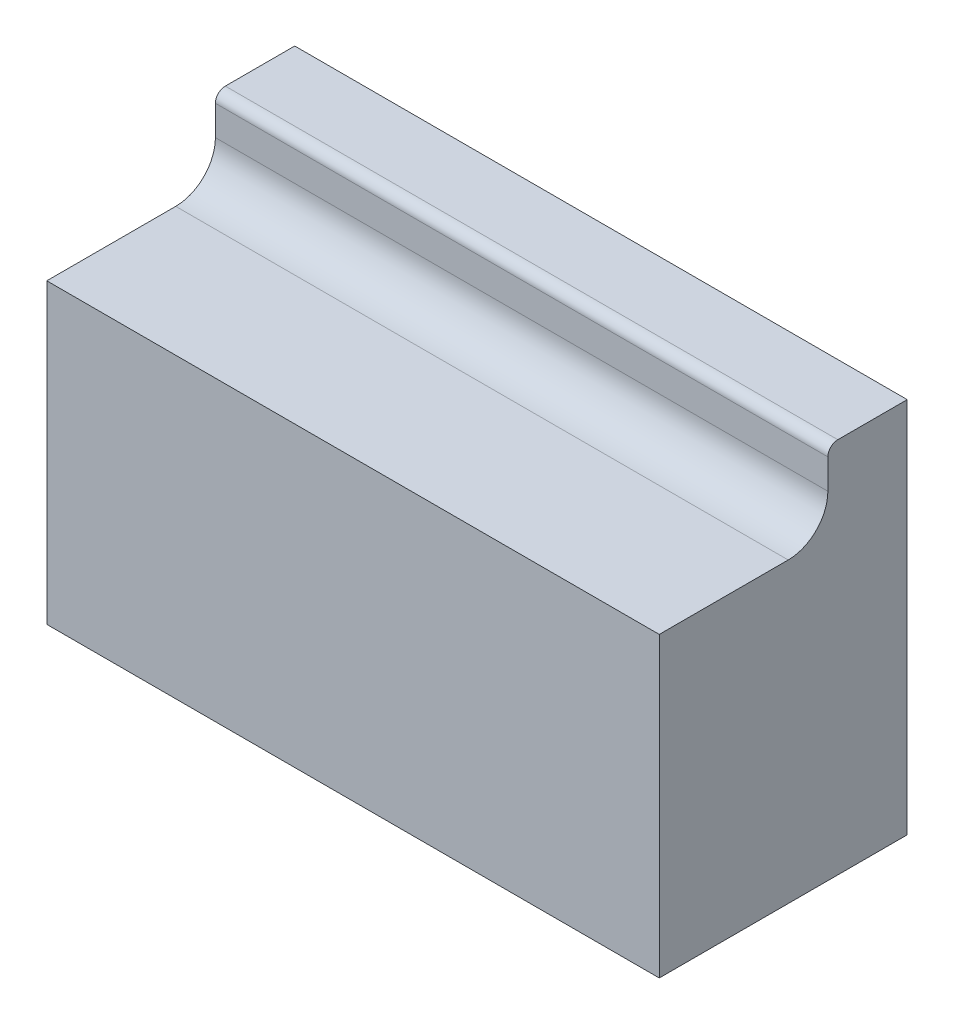
from build123d import *

# Parameters (mm, degrees)
SKETCH1_W           = 61.75
SKETCH1_H           = 38
BOSS_EXTRUDE1_DEPTH = 12.5
CUT_EXTRUDE1_REACH  = 75.575
FILLET1_R           = 1


with BuildPart() as part:
    # Sketch1 → Boss-Extrude1 (new, symmetric)
    with BuildSketch(Plane.XY):
        with Locations((36.590437788, -19)):
            Rectangle(SKETCH1_W, SKETCH1_H)
    extrude(amount=BOSS_EXTRUDE1_DEPTH, both=True)

    # Sketch2 → Cut-Extrude1 (cut, up to next)
    with BuildSketch(Plane(origin=(67.465437788, 0, 0), x_dir=(0, 0, -1), z_dir=(1, 0, 0)), mode=Mode.PRIVATE) as cut_extrude1_sk1:
        with BuildLine():
            Line((-12.5, -8), (0.500009615, -8))
            ThreePointArc((0.500009615, -8), (3.32843674, -6.828427125), (4.500009615, -4))
            Line((4.500009615, -4), (4.500009615, 0))
            Line((4.500009615, 0), (-12.5, 0))
            Line((-12.5, 0), (-12.5, -8))
        make_face()
    cut_extrude1_tool1 = extrude(cut_extrude1_sk1.sketch, amount=-CUT_EXTRUDE1_REACH, mode=Mode.PRIVATE) & part.part
    add(cut_extrude1_tool1.solids().sort_by_distance((67.465438, -3.919537, 4.197013))[0], mode=Mode.SUBTRACT)

    # Fillet1
    fillet1_edges = [part.edges().sort_by_distance(p)[0] for p in [
        (36.590437788, 0, -4.500009615),
    ]]
    fillet(fillet1_edges, radius=FILLET1_R)


solid = part.part
